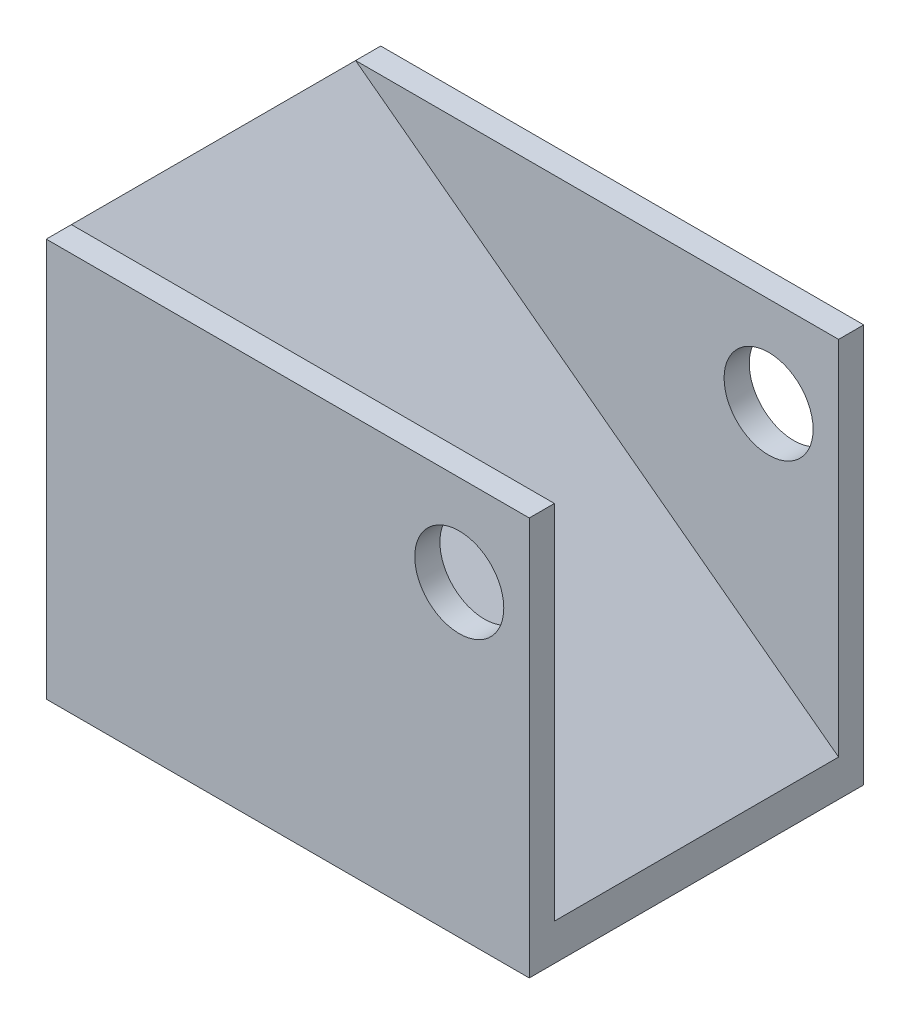
from build123d import *

# Parameters (mm, degrees)
BOSS_EXTRUDE6_DEPTH  = 2.05994
SKETCH9_W            = 27.13228
SKETCH9_H            = 1.41224
BOSS_EXTRUDE7_DEPTH  = 20.32
SKETCH10_R           = 2.50063
CUT_EXTRUDE3_DEPTH   = 25.4
BOSS_EXTRUDE10_DEPTH = 16.02994
SKETCH15_W           = 51.72964
SKETCH15_H           = 37.846
CUT_EXTRUDE5_DEPTH   = 64.999044225


with BuildPart() as part:
    # Sketch8 → Boss-Extrude6 (new body)
    with BuildSketch(Plane(origin=(0, 0, 0), x_dir=(1, 0, 0), z_dir=(0, 1, 0))):
        Polygon((-44.974060072, -2.900891689), (-44.974060072, -40.746891689), (2.165799928, -40.746891689), (2.165799928, -35.808024144), (6.755579928, -31.218244144), (33.887859928, -31.218244144), (33.887859928, -12.429539234), (6.755579928, -12.429539234), (2.165799928, -7.839759234), (2.165799928, -2.900891689), align=None)
    extrude(amount=BOSS_EXTRUDE6_DEPTH)

    # Sketch9 → Boss-Extrude7 (add)
    with BuildSketch(Plane(origin=(0, 2.05994, 0), x_dir=(1, 0, 0), z_dir=(0, 1, 0))):
        with Locations((20.321719928, -13.135659234)):
            Rectangle(SKETCH9_W, SKETCH9_H)
        with Locations((20.321719928, -30.512124144)):
            Rectangle(SKETCH9_W, SKETCH9_H)
    extrude(amount=BOSS_EXTRUDE7_DEPTH)

    # Sketch10 → Cut-Extrude3 (cut)
    with BuildSketch(Plane.XY.offset(31.218244144)):
        with Locations((29.955939928, 17.2847)):
            Circle(SKETCH10_R)
    extrude(amount=-CUT_EXTRUDE3_DEPTH, mode=Mode.SUBTRACT)

    # Sketch14 → Boss-Extrude10 (add)
    with BuildSketch(Plane.XY.offset(13.841779234)):
        Polygon((6.755579928, 22.37994), (33.887859928, 2.05994), (30.568919609, 2.05994), (6.755579928, 19.826826768), align=None)
    extrude(amount=BOSS_EXTRUDE10_DEPTH)

    # Sketch15 → Cut-Extrude5 (cut, through all)
    with BuildSketch(Plane(origin=(0, 2.05994, 0), x_dir=(1, 0, 0), z_dir=(0, 1, 0))):
        with Locations((-19.109240072, -21.823891689)):
            Rectangle(SKETCH15_W, SKETCH15_H)
    extrude(amount=-CUT_EXTRUDE5_DEPTH, mode=Mode.SUBTRACT)


solid = part.part
